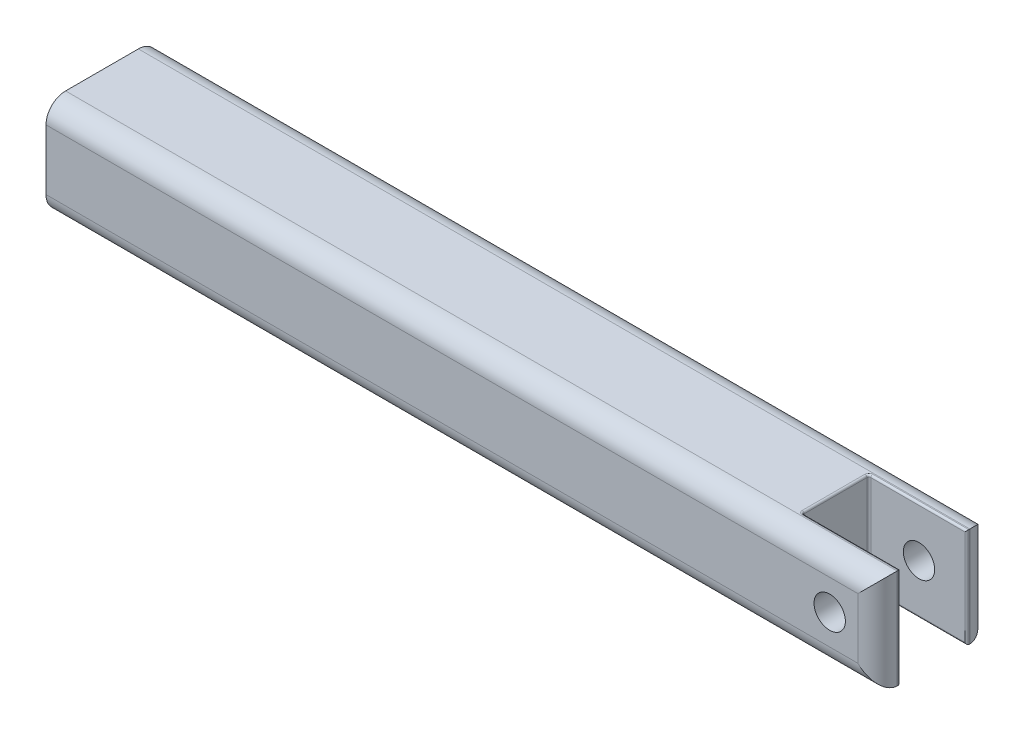
from build123d import *

# Parameters (mm, degrees)
SKETCH1_W               = 212.2
SKETCH1_H               = 25.4
BOSS_EXTRUDE1_DEPTH     = 14.2875
CUT_EXTRUDE2_DEPTH      = 108.808314412
CUT_EXTRUDE2_DEPTH_BACK = 108.808314412
SKETCH2_R               = 4
CUT_EXTRUDE3_DEPTH      = 108.808314412
CUT_EXTRUDE3_DEPTH_BACK = 108.808314412
SKETCH3_W               = 25
SKETCH3_H               = 17
FILLET3_R               = 5
FILLET4_R               = 0.5


with BuildPart() as part:
    # Sketch1 → Boss-Extrude1 (new, symmetric)
    with BuildSketch(Plane.XY):
        Rectangle(SKETCH1_W, SKETCH1_H)
    extrude(amount=BOSS_EXTRUDE1_DEPTH, both=True)

    # Sketch2 → Cut-Extrude2 (cut, two sides: drawn at the far end of the back side and taken through both)
    with BuildSketch(Plane.XY.offset(-CUT_EXTRUDE2_DEPTH_BACK)):
        with Locations((93.9, 0)):
            Circle(SKETCH2_R)
    extrude(amount=CUT_EXTRUDE2_DEPTH + CUT_EXTRUDE2_DEPTH_BACK, mode=Mode.SUBTRACT)

    # Sketch3 → Cut-Extrude3 (cut, two sides: drawn at the far end of the back side and taken through both)
    with BuildSketch(Plane(origin=(0, 0, 0), x_dir=(1, 0, 0), z_dir=(0, 1, 0)).offset(-CUT_EXTRUDE3_DEPTH_BACK)):
        with Locations((93.6, 0)):
            Rectangle(SKETCH3_W, SKETCH3_H)
    extrude(amount=CUT_EXTRUDE3_DEPTH + CUT_EXTRUDE3_DEPTH_BACK, mode=Mode.SUBTRACT)

    # Fillet3
    fillet3_edges = [part.edges().sort_by_distance(p)[0] for p in [
        (106.1, 0, -14.2875),
        (106.1, 0, 14.2875),
        (0, -12.7, 14.2875),
        (0, -12.7, -14.2875),
        (0, 12.7, -14.2875),
        (0, 12.7, 14.2875),
    ]]
    fillet(fillet3_edges, radius=FILLET3_R)

    # Fillet4
    fillet4_edges = [part.edges().sort_by_distance(p)[0] for p in [
        (81.1, -12.7, 0),
        (81.1, 12.7, 0),
        (93.6, -12.7, -8.5),
        (106.1, 0, 8.5),
        (93.6, -12.7, 8.5),
        (93.6, 12.7, 8.5),
        (81.1, 0, 8.5),
        (93.6, 12.7, -8.5),
        (81.1, 0, -8.5),
        (106.1, 0, -8.5),
    ]]
    fillet(fillet4_edges, radius=FILLET4_R)


solid = part.part
